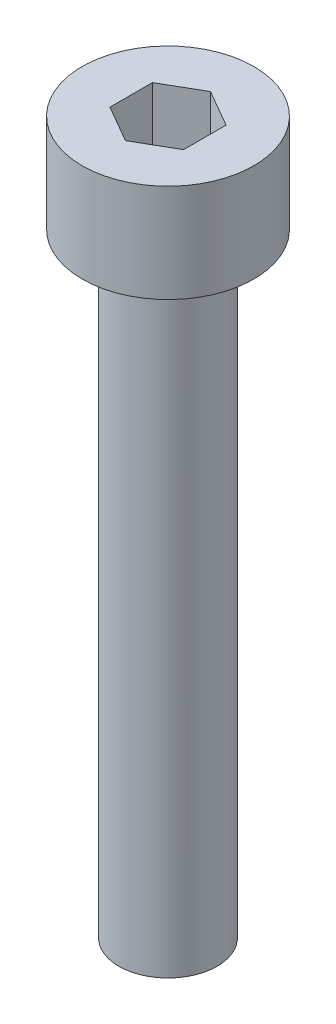
from build123d import *

# Parameters (mm, degrees)
SKETCH2_R           = 3.5
BOSS_EXTRUDE1_DEPTH = 4
SKETCH3_R           = 2
BOSS_EXTRUDE2_DEPTH = 25


with BuildPart() as part:
    # Sketch2 → Boss-Extrude1 (new body)
    with BuildSketch(Plane(origin=(0, 0, 0), x_dir=(1, 0, 0), z_dir=(0, 1, 0))):
        Circle(SKETCH2_R)
        Polygon((0, 1.732050808), (-1.5, 0.866025404), (-1.5, -0.866025404), (0, -1.732050808), (1.5, -0.866025404), (1.5, 0.866025404), align=None, mode=Mode.SUBTRACT)
    extrude(amount=BOSS_EXTRUDE1_DEPTH)

    # Sketch3 → Boss-Extrude2 (add)
    with BuildSketch(Plane.XZ):
        Circle(SKETCH3_R)
    extrude(amount=BOSS_EXTRUDE2_DEPTH)


solid = part.part
